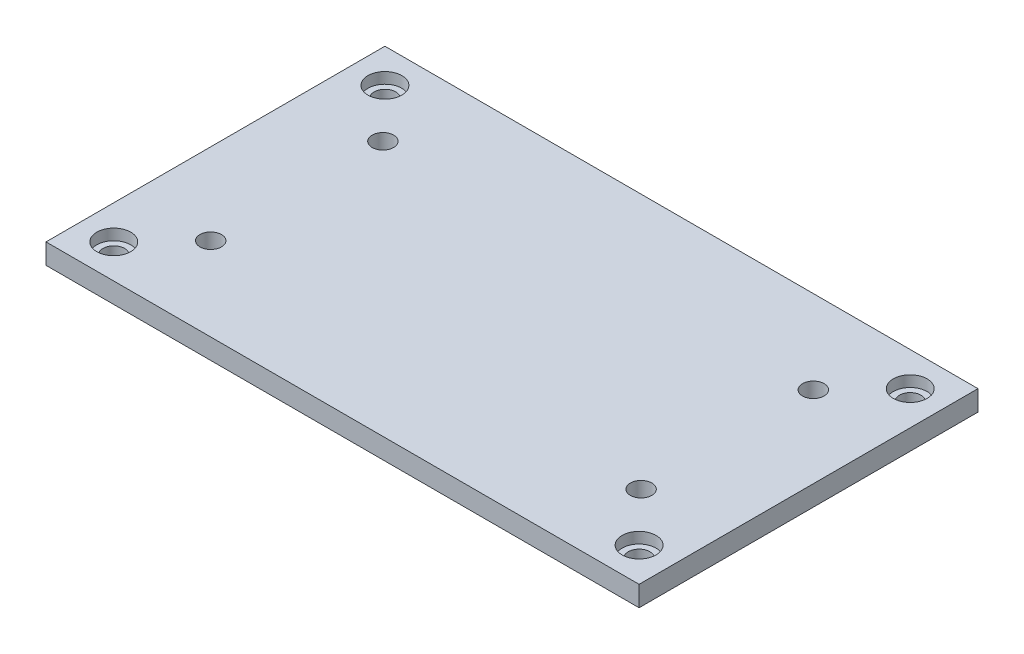
from build123d import *

# Parameters (mm, degrees)
SKETCH1_W           = 175
SKETCH1_H           = 100
SKETCH1_R           = 3.175
BOSS_EXTRUDE1_DEPTH = 6
SKETCH2_R           = 5
CUT_EXTRUDE1_DEPTH  = 3.25


with BuildPart() as part:
    # Sketch1 → Boss-Extrude1 (new body)
    with BuildSketch(Plane(origin=(0, 0, 0), x_dir=(1, 0, 0), z_dir=(0, 1, 0))):
        Rectangle(SKETCH1_W, SKETCH1_H)
        with Locations((-77.5, -40)):
            Circle(SKETCH1_R, mode=Mode.SUBTRACT)
        with Locations((-77.5, 40)):
            Circle(SKETCH1_R, mode=Mode.SUBTRACT)
        with Locations((77.5, 40)):
            Circle(SKETCH1_R, mode=Mode.SUBTRACT)
        with Locations((77.5, -40)):
            Circle(SKETCH1_R, mode=Mode.SUBTRACT)
        with Locations((-63.5, 25.4)):
            Circle(SKETCH1_R, mode=Mode.SUBTRACT)
        with Locations((-63.5, -25.4)):
            Circle(SKETCH1_R, mode=Mode.SUBTRACT)
        with Locations((63.5, -25.4)):
            Circle(SKETCH1_R, mode=Mode.SUBTRACT)
        with Locations((63.5, 25.4)):
            Circle(SKETCH1_R, mode=Mode.SUBTRACT)
    extrude(amount=BOSS_EXTRUDE1_DEPTH)

    # Sketch2 → Cut-Extrude1 (cut)
    with BuildSketch(Plane(origin=(0, 6, 0), x_dir=(1, 0, 0), z_dir=(0, 1, 0))):
        with Locations((-77.5, 40)):
            Circle(SKETCH2_R)
        with Locations((-77.5, -40)):
            Circle(SKETCH2_R)
        with Locations((77.5, -40)):
            Circle(SKETCH2_R)
        with Locations((77.5, 40)):
            Circle(SKETCH2_R)
    extrude(amount=-CUT_EXTRUDE1_DEPTH, mode=Mode.SUBTRACT)


solid = part.part
